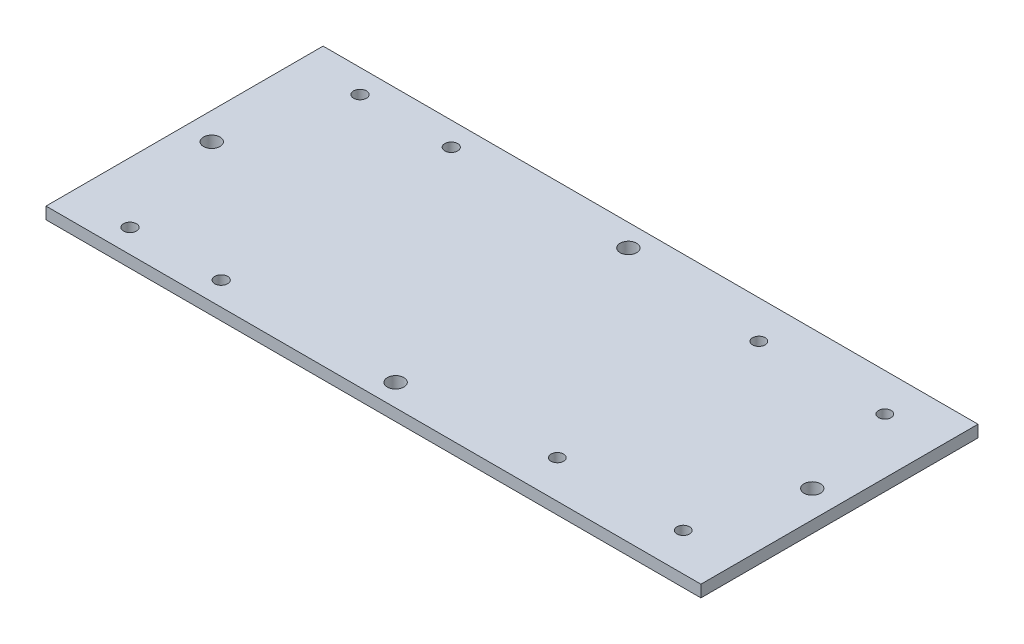
from build123d import *

# Parameters (mm, degrees)
SKETCH1_W           = 165.1
SKETCH1_H           = 69.85
BOSS_EXTRUDE1_DEPTH = 3
SKETCH3_R           = 2.0828
CUT_EXTRUDE2_DEPTH  = 5.08
SKETCH4_R           = 1.625
CUT_EXTRUDE3_DEPTH  = 17.78
SKETCH5_R           = 1.5875
CUT_EXTRUDE4_DEPTH  = 7.874


with BuildPart() as part:
    # Sketch1 → Boss-Extrude1 (new body)
    with BuildSketch(Plane(origin=(0, 0, 0), x_dir=(1, 0, 0), z_dir=(0, 1, 0))):
        Rectangle(SKETCH1_W, SKETCH1_H)
    extrude(amount=BOSS_EXTRUDE1_DEPTH)

    # Sketch3 → Cut-Extrude2 (cut)
    with BuildSketch(Plane(origin=(0, 3, 0), x_dir=(1, 0, 0), z_dir=(0, 1, 0))):
        with Locations((-75.692, 0)):
            Circle(SKETCH3_R)
        with Locations((75.692, 0)):
            Circle(SKETCH3_R)
        with Locations((0, -29.337)):
            Circle(SKETCH3_R)
        with Locations((0, 29.337)):
            Circle(SKETCH3_R)
    extrude(amount=-CUT_EXTRUDE2_DEPTH, mode=Mode.SUBTRACT)

    # Sketch4 → Cut-Extrude3 (cut)
    with BuildSketch(Plane(origin=(0, 3, 0), x_dir=(1, 0, 0), z_dir=(0, 1, 0))):
        with Locations((-67.31, 29)):
            Circle(SKETCH4_R)
        with Locations((-44.31, 29)):
            Circle(SKETCH4_R)
        with Locations((-44.31, -29)):
            Circle(SKETCH4_R)
        with Locations((-67.31, -29)):
            Circle(SKETCH4_R)
    extrude(amount=-CUT_EXTRUDE3_DEPTH, mode=Mode.SUBTRACT)

    # Sketch5 → Cut-Extrude4 (cut)
    with BuildSketch(Plane(origin=(0, 3, 0), x_dir=(1, 0, 0), z_dir=(0, 1, 0))):
        with Locations((68.58, -25.4)):
            Circle(SKETCH5_R)
        with Locations((68.58, 25.4)):
            Circle(SKETCH5_R)
        with Locations((36.83, 25.4)):
            Circle(SKETCH5_R)
        with Locations((36.83, -25.4)):
            Circle(SKETCH5_R)
    extrude(amount=-CUT_EXTRUDE4_DEPTH, mode=Mode.SUBTRACT)


solid = part.part
